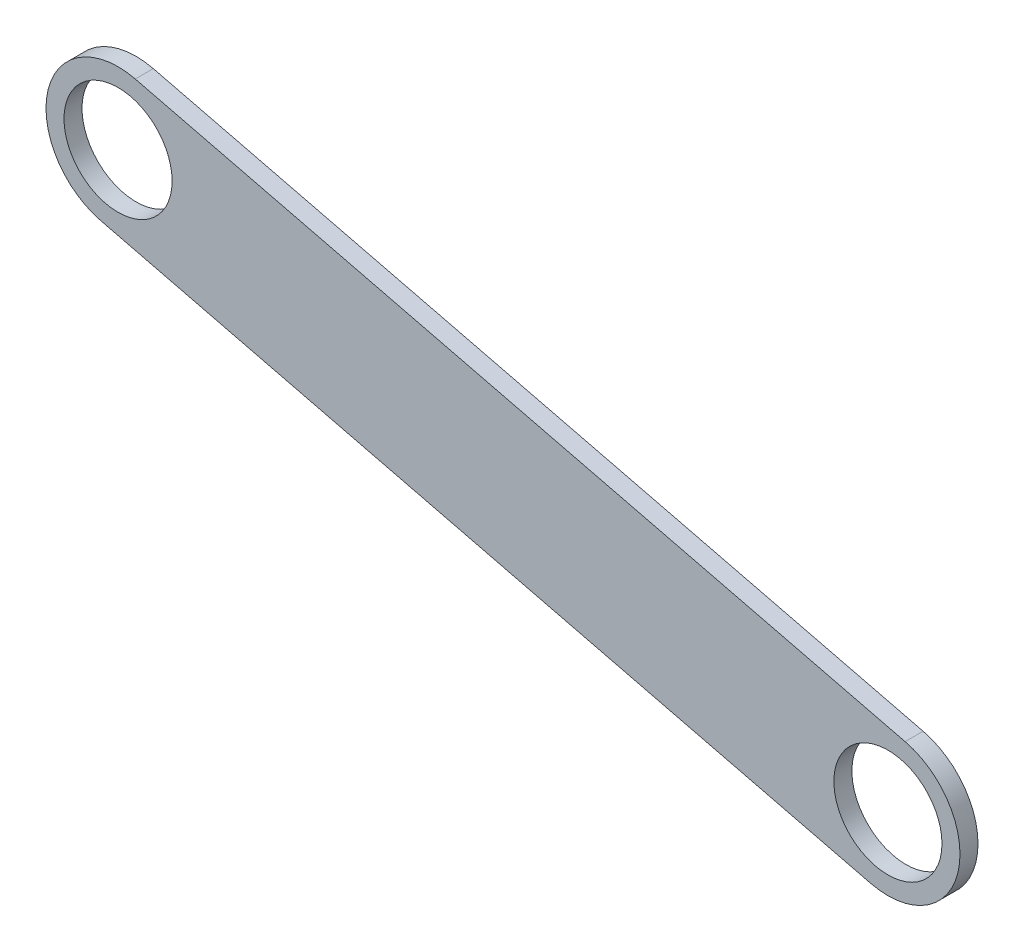
from build123d import *

# Parameters (mm, degrees)
ESQUISSE1_R               = 3
T_LE_DE_BASE_PLI_E1_DEPTH = 1


# Sheet-metal steps are written as plain solids
with BuildPart() as part:
    # Esquisse1 → Tôle de base pliée1 (new body)
    with BuildSketch(Plane.XY):
        with BuildLine():
            Line((-48.923151707, 19.368213843), (-6.191027973, 8.881765388))
            ThreePointArc((-6.191027973, 8.881765388), (-3.259602948, 4.043713371), (-8.097654965, 1.112288345))
            Line((-8.097654965, 1.112288345), (-50.829778699, 11.5987368))
            ThreePointArc((-50.829778699, 11.5987368), (-53.761203724, 16.436788817), (-48.923151707, 19.368213843))
        make_face()
        with Locations((-49.876465203, 15.483475321)):
            Circle(ESQUISSE1_R, mode=Mode.SUBTRACT)
        with Locations((-7.144341469, 4.997026867)):
            Circle(ESQUISSE1_R, mode=Mode.SUBTRACT)
    extrude(amount=-T_LE_DE_BASE_PLI_E1_DEPTH)


solid = part.part
